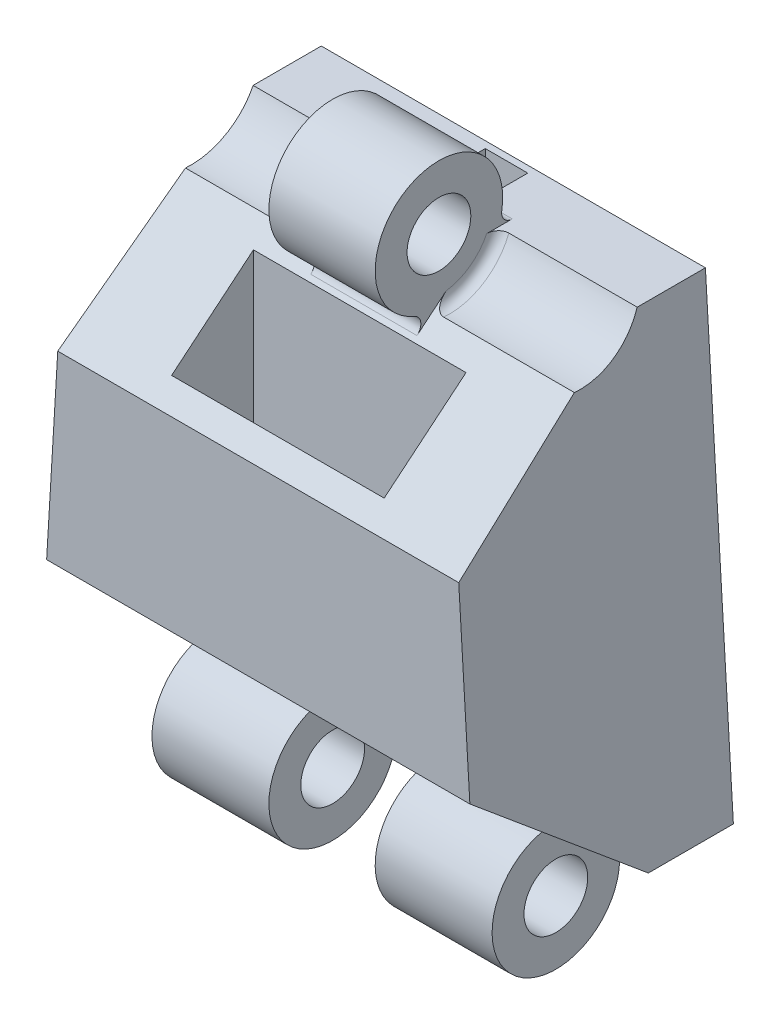
from build123d import *

# Parameters (mm, degrees)
BOSS_EXTRUDE1_DEPTH            = 12
CUT_EXTRUDE1_DEPTH             = 28.113370808
CUT_EXTRUDE1_DEPTH_BACK        = 28.113370808
SKETCH6_R                      = 3
SKETCH6_R_2                    = 1.5
BOSS_EXTRUDE2_DEPTH            = 8
SKETCH6_3_R                    = 3
SKETCH6_3_R_2                  = 1.5
CUT_EXTRUDE2_DEPTH             = 2.5
CUT_EXTRUDE3_DEPTH             = 28.113370808
CUT_EXTRUDE3_DEPTH_BACK        = 28.113370808
SKETCH9_R                      = 3
SKETCH9_R_2                    = 1.5
BOSS_EXTRUDE3_DEPTH            = 2.5
CUT_EXTRUDE4_START             = 10
SKETCH11_R                     = 3
CUT_EXTRUDE4_DEPTH             = 10
SKETCH12_R                     = 3
CUT_EXTRUDE5_DEPTH             = 10
FILLET1_R                      = 0.5
FILLET2_R                      = 0.5
CUT_EXTRUDE6_REACH             = 62.032
SKETCH14_W                     = 10
SKETCH14_H                     = 3.849855631
CUT_EXTRUDE6_DIRECTION_2_REACH = 62.032
CUT_EXTRUDE7_DEPTH             = 1


with BuildPart() as part:
    # Sketch1 → Boss-Extrude1 (new body)
    with BuildSketch(Plane.XY):
        Polygon((-56.5742778, 0), (-35.873082033, 0), (-37.188679916, 22), (-55.258679916, 22), align=None)
    extrude(amount=BOSS_EXTRUDE1_DEPTH)

    # Sketch3 → Cut-Extrude1 (cut, two sides: drawn at the far end of the back side and taken through both)
    with BuildSketch(Plane(origin=(-46.223679916, 0, 0), x_dir=(0, 0, -1), z_dir=(1, 0, 0)).offset(-CUT_EXTRUDE1_DEPTH_BACK)):
        Polygon((-12, 0), (-4, 0), (-12, 6.613954944), align=None)
    extrude(amount=CUT_EXTRUDE1_DEPTH + CUT_EXTRUDE1_DEPTH_BACK, mode=Mode.SUBTRACT)

    # Sketch6 → Boss-Extrude2 (add, symmetric)
    with BuildSketch(Plane(origin=(-46.223679916, 0, 0), x_dir=(0, 0, -1), z_dir=(1, 0, 0))):
        with Locations((-6, -1.1)):
            Circle(SKETCH6_R)
        with Locations((-6, -1.1)):
            Circle(SKETCH6_R_2, mode=Mode.SUBTRACT)
    extrude(amount=BOSS_EXTRUDE2_DEPTH, both=True)

    # Sketch6<3> → Cut-Extrude2 (cut, symmetric)
    with BuildSketch(Plane(origin=(-46.223679916, 0, 0), x_dir=(0, 0, -1), z_dir=(1, 0, 0))):
        with Locations((-6, -1.1)):
            Circle(SKETCH6_3_R)
        with Locations((-6, -1.1)):
            Circle(SKETCH6_3_R_2, mode=Mode.SUBTRACT)
    extrude(amount=CUT_EXTRUDE2_DEPTH, both=True, mode=Mode.SUBTRACT)

    # Sketch8 → Cut-Extrude3 (cut, two sides: drawn at the far end of the back side and taken through both)
    with BuildSketch(Plane(origin=(-46.223679916, 0, 0), x_dir=(0, 0, -1), z_dir=(1, 0, 0)).offset(-CUT_EXTRUDE3_DEPTH_BACK)):
        Polygon((-12, 15.370362001), (-4, 22), (-12, 22), align=None)
    extrude(amount=CUT_EXTRUDE3_DEPTH + CUT_EXTRUDE3_DEPTH_BACK, mode=Mode.SUBTRACT)

    # Sketch9 → Boss-Extrude3 (add, symmetric)
    with BuildSketch(Plane(origin=(-46.223679916, 0, 0), x_dir=(0, 0, -1), z_dir=(1, 0, 0))):
        with Locations((-6, 23.1)):
            Circle(SKETCH9_R)
        with Locations((-6, 23.1)):
            Circle(SKETCH9_R_2, mode=Mode.SUBTRACT)
    extrude(amount=BOSS_EXTRUDE3_DEPTH, both=True)

    # Sketch11 → Cut-Extrude4 (cut)
    with BuildSketch(Plane(origin=(-43.723679916, 0, 0), x_dir=(0, 0, -1), z_dir=(1, 0, 0)).offset(CUT_EXTRUDE4_START)):
        with Locations((-6, 23.1)):
            Circle(SKETCH11_R)
    extrude(amount=-CUT_EXTRUDE4_DEPTH, mode=Mode.SUBTRACT)

    # Sketch12 → Cut-Extrude5 (cut)
    with BuildSketch(Plane.ZY.offset(48.723679916)):
        with Locations((6, 23.1)):
            Circle(SKETCH12_R)
    extrude(amount=CUT_EXTRUDE5_DEPTH, mode=Mode.SUBTRACT)

    # Fillet1
    fillet1_edges = [part.edges().sort_by_distance(p)[0] for p in [
        (-46.223679916, 22, 3.208942853),
        (-46.223679916, 20.112838065, 6.277242812),
    ]]
    fillet(fillet1_edges, radius=FILLET1_R)

    # Fillet2
    fillet2_edges = [part.edges().sort_by_distance(p)[0] for p in [
        (-48.723679916, 20.54464497, 4.42832552),
        (-43.723679916, 20.54464497, 4.42832552),
    ]]
    fillet(fillet2_edges, radius=FILLET2_R)

    # Cut-Extrude6: up to this plane
    cut_extrude6_end = Plane(origin=(-56.5742778, -1.96433929, 1.624006445), z_dir=(0, 0.7707129094412332, -0.6371825572162422))
    # Sketch14 → Cut-Extrude6 (cut, up to the surface)
    with BuildSketch(Plane(origin=(0, 10, 0), x_dir=(1, 0, 0), z_dir=(0, 1, 0)), mode=Mode.PRIVATE) as cut_extrude6_sk1:
        with Locations((-46.223679916, -9.151106834)):
            Rectangle(SKETCH14_W, SKETCH14_H)
    cut_extrude6_tool1 = split(extrude(cut_extrude6_sk1.sketch, amount=-CUT_EXTRUDE6_REACH, mode=Mode.PRIVATE), bisect_by=cut_extrude6_end, keep=Keep.BOTH, mode=Mode.PRIVATE)
    add(cut_extrude6_tool1.solids().sort_by_distance((-46.22368, 10, 9.151107))[0], mode=Mode.SUBTRACT)

    # Cut-Extrude6 direction 2: up to this plane
    cut_extrude6_direction_2_end = Plane(origin=(-56.5742778, 15.008030561, 12.437226213), z_dir=(0, 0.769971126082772, 0.6380787294674757))
    # Sketch14 → Cut-Extrude6 direction 2 (cut, up to the surface)
    with BuildSketch(Plane(origin=(0, 10, 0), x_dir=(1, 0, 0), z_dir=(0, 1, 0)), mode=Mode.PRIVATE) as cut_extrude6_direction_2_sk1:
        with Locations((-46.223679916, -9.151106834)):
            Rectangle(SKETCH14_W, SKETCH14_H)
    cut_extrude6_direction_2_tool1 = split(extrude(cut_extrude6_direction_2_sk1.sketch, amount=CUT_EXTRUDE6_DIRECTION_2_REACH, mode=Mode.PRIVATE), bisect_by=cut_extrude6_direction_2_end, keep=Keep.BOTH, mode=Mode.PRIVATE)
    add(cut_extrude6_direction_2_tool1.solids().sort_by_distance((-46.22368, 10, 9.151107))[0], mode=Mode.SUBTRACT)

    # Sketch15 → Cut-Extrude7 (cut, symmetric)
    with BuildSketch(Plane(origin=(-46.223679916, 0, 0), x_dir=(0, 0, -1), z_dir=(1, 0, 0))):
        Polygon((-0.32, 0), (-2.32, 0), (-2.32, 0.335573932), (-2.32, 22), (-0.32, 22), (-0.32, 0.335573932), align=None)
    extrude(amount=CUT_EXTRUDE7_DEPTH, both=True, mode=Mode.SUBTRACT)


solid = part.part
